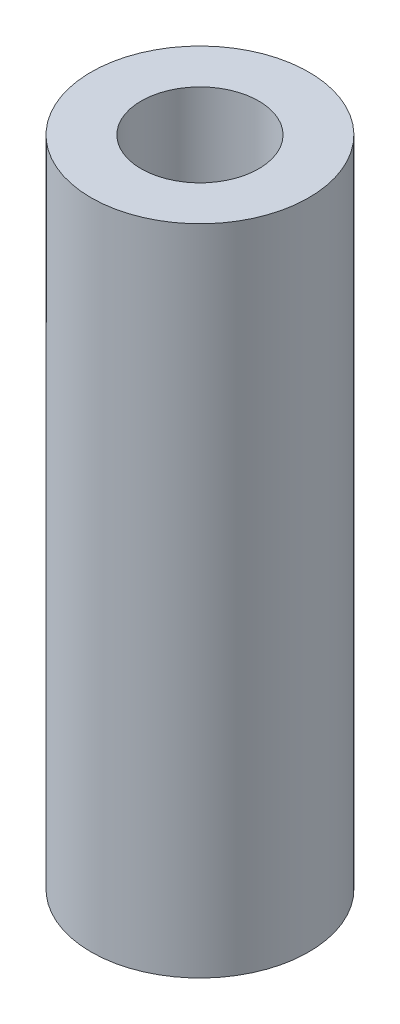
from build123d import *

# Parameters (mm, degrees)
SKETCH1_R           = 10
SKETCH1_R_2         = 5.4
BOSS_EXTRUDE1_DEPTH = 60
SKETCH1_2_R         = 5.4
BOSS_EXTRUDE2_DEPTH = 10


with BuildPart() as part:
    # Sketch1 → Boss-Extrude1 (new body)
    with BuildSketch(Plane(origin=(0, 0, 0), x_dir=(1, 0, 0), z_dir=(0, 1, 0))):
        Circle(SKETCH1_R)
        Circle(SKETCH1_R_2, mode=Mode.SUBTRACT)
    extrude(amount=BOSS_EXTRUDE1_DEPTH)

    # Sketch1<2> → Boss-Extrude2 (add)
    with BuildSketch(Plane(origin=(0, 0, 0), x_dir=(1, 0, 0), z_dir=(0, 1, 0))):
        Circle(SKETCH1_2_R)
    extrude(amount=BOSS_EXTRUDE2_DEPTH)


solid = part.part
